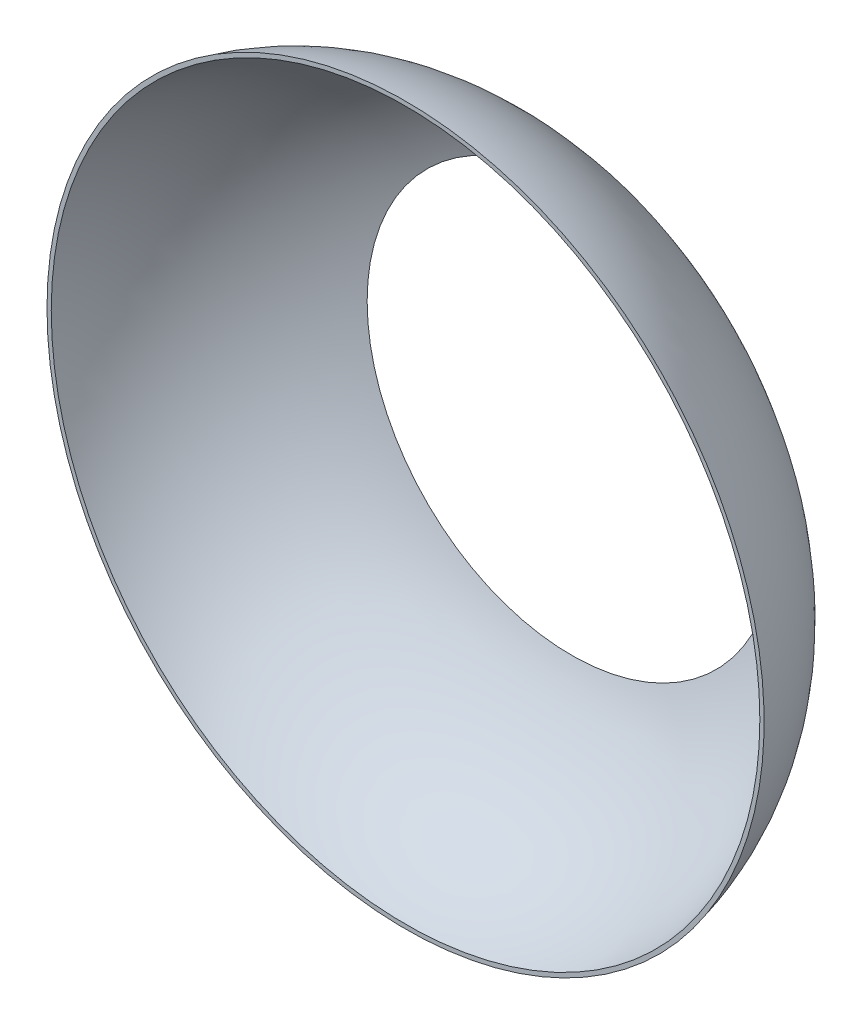
from build123d import *


# Read off the part's stored shape, not the designer's step: Shell1
with BuildPart() as part:
    # Sketch3 → Revolve1 (revolve)
    with BuildSketch(Plane(origin=(0, 0, 0), x_dir=(1, 0, 0), z_dir=(0, 1, 0))):
        with BuildLine():
            Line((-26.066666667, 0), (0, 0))
            Line((0, 0), (0, -20))
            Line((0, -20), (-43.188888889, -20))
            ThreePointArc((-43.188888889, -20), (-37.098265739, -7.884987806), (-26.066666667, 0))
        make_face()
    revolve(axis=Axis((0, 0, 0), (0, 0, 1)))

    # Shell1 outline → Shell1 (revolve, cut)
    with BuildSketch(Plane.XZ):
        with BuildLine():
            Line((42.675881, 20), (0, 20))
            Line((0, 20), (0, 0))
            Line((0, 0), (24.625680859, 0))
            ThreePointArc((24.625680859, 0), (36.238688321, 7.664387682), (42.675881, 20))
        make_face()
    revolve(axis=Axis((0, 0, 0), (0, 0, 1)), mode=Mode.SUBTRACT)


solid = part.part
